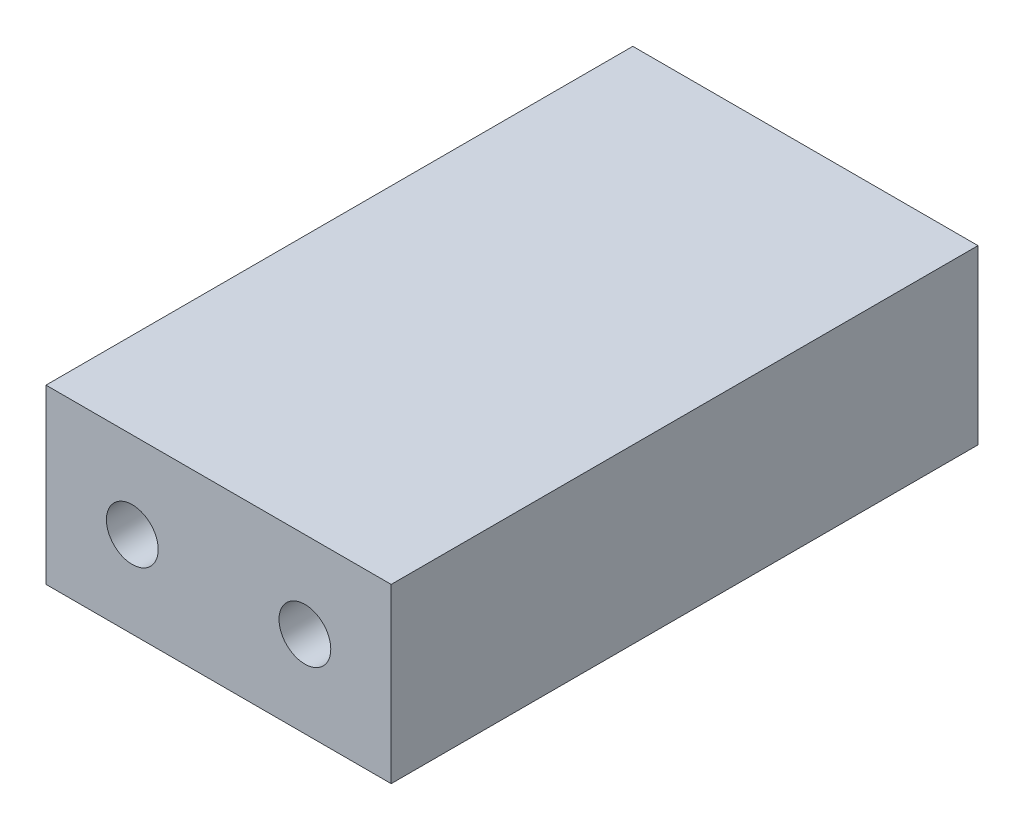
from build123d import *

# Parameters (mm, degrees)
SKETCH2_W           = 20
SKETCH2_H           = 10
BOSS_EXTRUDE1_DEPTH = 34
SKETCH3_R           = 1.5
CUT_EXTRUDE1_DEPTH  = 6
CUT_EXTRUDE2_START  = -6
SKETCH4_R           = 1.5
CUT_EXTRUDE2_DEPTH  = 6


with BuildPart() as part:
    # Sketch2 → Boss-Extrude1 (new body)
    with BuildSketch(Plane.XY):
        Rectangle(SKETCH2_W, SKETCH2_H)
    extrude(amount=BOSS_EXTRUDE1_DEPTH)

    # Sketch3 → Cut-Extrude1 (cut)
    with BuildSketch(Plane.XY.offset(34)):
        with Locations((-5, 0)):
            Circle(SKETCH3_R)
        with Locations((5, 0)):
            Circle(SKETCH3_R)
    extrude(amount=-CUT_EXTRUDE1_DEPTH, mode=Mode.SUBTRACT)

    # Sketch4 → Cut-Extrude2 (cut)
    with BuildSketch(Plane(origin=(0, 0, 0), x_dir=(-1, 0, 0), z_dir=(0, 0, -1)).offset(CUT_EXTRUDE2_START)):
        with Locations((-5, 0)):
            Circle(SKETCH4_R)
        with Locations((5, 0)):
            Circle(SKETCH4_R)
    extrude(amount=CUT_EXTRUDE2_DEPTH, mode=Mode.SUBTRACT)


solid = part.part
